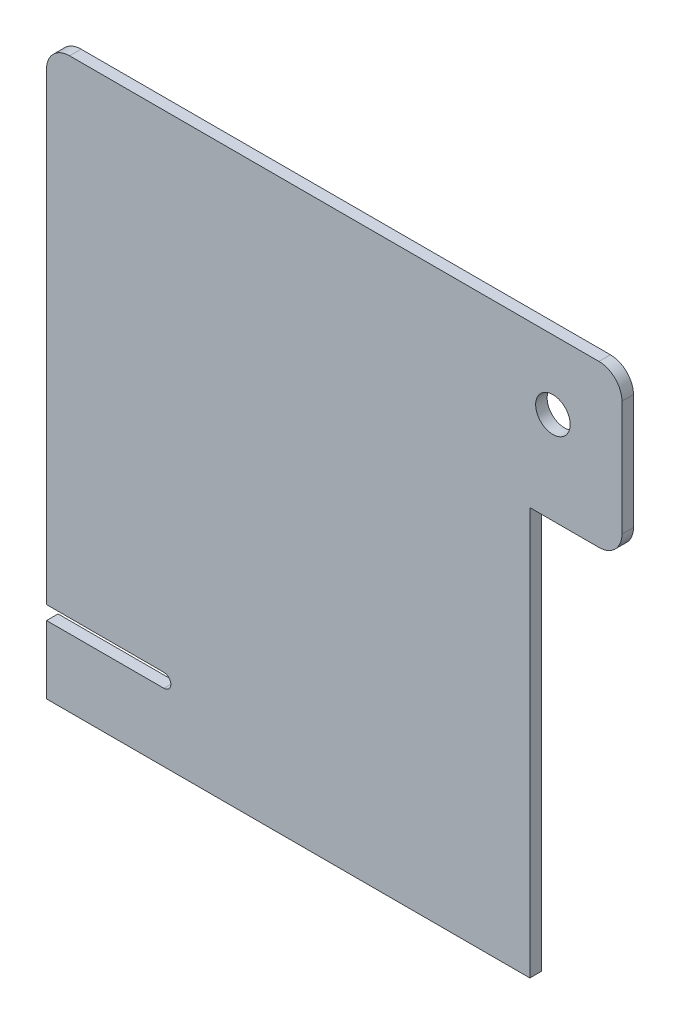
from build123d import *

# Parameters (mm, degrees)
EXTRUDE_1_DEPTH     = 5
SKETCH_2_R          = 7.5
CUT_EXTRUDE_1_DEPTH = 5
SKETCH_3_W          = 5
SKETCH_3_H          = 6
CUT_EXTRUDE_3_DEPTH = 51
CUT_EXTRUDE_4_REACH = 353.474


with BuildPart() as part:
    # 草图1 → 凸台-拉伸1 (new body)
    with BuildSketch(Plane.XY):
        with BuildLine():
            Line((210, -247), (210, -237))
            Line((210, -237), (210, -70))
            Line((210, -70), (210, 0))
            Line((210, 0), (10, 0))
            ThreePointArc((10, 0), (2.928932188, -2.928932188), (0, -10))
            Line((0, -10), (0, -237))
            Line((0, -237), (0, -247))
            Line((0, -247), (10, -247))
            Line((10, -247), (200, -247))
            Line((200, -247), (210, -247))
        make_face()
        with BuildLine():
            Line((210, 0), (210, -70))
            Line((210, -70), (240, -70))
            ThreePointArc((240, -70), (247.071067812, -67.071067812), (250, -60))
            Line((250, -60), (250, -10))
            ThreePointArc((250, -10), (247.071067812, -2.928932188), (240, 0))
            Line((240, 0), (210, 0))
        make_face()
    extrude(amount=EXTRUDE_1_DEPTH)

    # 草图2 → 切除-拉伸1 (cut)
    with BuildSketch(Plane.XY.offset(5)):
        with Locations((220, -30)):
            Circle(SKETCH_2_R)
    extrude(amount=-CUT_EXTRUDE_1_DEPTH, mode=Mode.SUBTRACT)

    # 草图3 → 切除-拉伸3 (cut)
    with BuildSketch(Plane.ZY):
        with Locations((2.5, -214.5)):
            Rectangle(SKETCH_3_W, SKETCH_3_H)
    extrude(amount=-CUT_EXTRUDE_3_DEPTH, mode=Mode.SUBTRACT)

    # 草图4 → 切除-拉伸4 (cut, up to next)
    with BuildSketch(Plane.XY.offset(5), mode=Mode.PRIVATE) as cut_extrude_4_sk1:
        with BuildLine():
            Line((51, -211.5), (51, -217.5))
            ThreePointArc((51, -217.5), (54, -214.5), (51, -211.5))
        make_face()
    cut_extrude_4_tool1 = extrude(cut_extrude_4_sk1.sketch, amount=-CUT_EXTRUDE_4_REACH, mode=Mode.PRIVATE) & part.part
    add(cut_extrude_4_tool1.solids().sort_by_distance((52.27324, -214.5, 5))[0], mode=Mode.SUBTRACT)


solid = part.part
